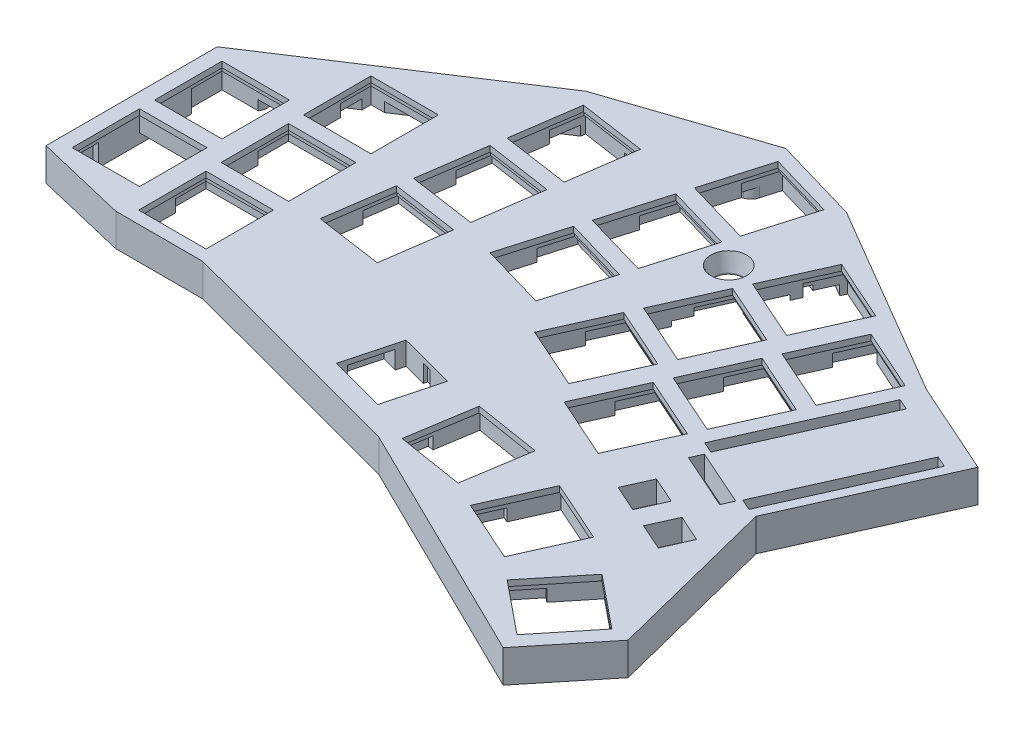
from build123d import *

# Parameters (mm, degrees)
LAYOUT_BASED_ON_OG_W     = 13.9
LAYOUT_BASED_ON_OG_H     = 13.9
LAYOUT_BASED_ON_OG_R     = 3
TOP_PLATE_DEPTH          = 1.2
BOSS_EXTRUDE2_START      = -5.5
LAYOUT_BASED_ON_OG_7_R   = 1
LAYOUT_BASED_ON_OG_7_W   = 13.9
LAYOUT_BASED_ON_OG_7_H   = 13.9
LAYOUT_BASED_ON_OG_7_R_2 = 3
BOSS_EXTRUDE2_DEPTH      = 5.5
SKETCH1_W                = 14.7
SKETCH1_H                = 14.7
CUT_EXTRUDE1_DEPTH       = 5.5
CUT_EXTRUDE2_DEPTH       = 5.7
SKETCH5_W                = 17
SKETCH5_H                = 7.4
CUT_EXTRUDE3_DEPTH       = 4.5
CUT_EXTRUDE4_DEPTH       = 2.2
SKETCH8_R                = 2.5
SKETCH8_R_2              = 2.25
CUT_EXTRUDE5_DEPTH       = 2
FILLET1_R                = 0.75
CUT_EXTRUDE6_DEPTH       = 1
CHAMFER1_SIZE            = 0.7
CHAMFER1_SIZE2           = 3.5


with BuildPart() as part:
    # Layout Based on OG → Top Plate (new body)
    with BuildSketch(Plane(origin=(0, 0, 0), x_dir=(1, 0, 0), z_dir=(0, 1, 0))):
        Polygon((44.932112641, 64.586160661), (-1, 34.518088786), (-1, -0.789622065), (17.882445607, -5.291259199), (35.868672805, -5.291259199), (85.361540778, -18.518913408), (135.758281381, -43.294373445), (147.28611756, -29.083818781), (138.36478836, 6.221102631), (152.486966257, 37.866376671), (133.367786474, 46.398597243), (93.420652892, 69.813076074), (75.723768858, 74.969568789), align=None)
        with Locations((9, 8.5)):
            Rectangle(LAYOUT_BASED_ON_OG_W, LAYOUT_BASED_ON_OG_H, mode=Mode.SUBTRACT)
        with Locations((27, 4.208740801)):
            Rectangle(LAYOUT_BASED_ON_OG_W, LAYOUT_BASED_ON_OG_H, mode=Mode.SUBTRACT)
        Polygon((82.42671831, -1.483486994), (79.405763835, -12.786753516), (67.812669966, -9.68833867), (70.833624441, 1.614927852), align=None, mode=Mode.SUBTRACT)
        Polygon((124.073654328, -30.793104213), (132.830543438, -19.998341913), (143.625305738, -28.755231024), (134.868416628, -39.549993323), align=None, mode=Mode.SUBTRACT)
        Polygon((106.968309305, -21.25715678), (112.632924584, -8.563767408), (125.326313955, -14.228382687), (119.661698676, -26.921772059), align=None, mode=Mode.SUBTRACT)
        Polygon((87.98288219, -16.369909233), (90.169189468, -2.642926298), (103.896172402, -4.829233576), (101.709865125, -18.55621651), align=None, mode=Mode.SUBTRACT)
        Polygon((103.849381672, 19.547250989), (116.542771044, 13.88263571), (110.878155765, 1.189246339), (98.184766393, 6.853861618), align=None, mode=Mode.SUBTRACT)
        Polygon((124.470413663, -5.2830693), (118.991252783, -2.837911626), (121.436410458, 2.641249254), (126.915571338, 0.19609158), align=None, mode=Mode.SUBTRACT)
        Polygon((133.940230051, -9.509116814), (128.461069171, -7.06395914), (130.906226845, -1.58479826), (136.385387725, -4.029955934), align=None, mode=Mode.SUBTRACT)
        Polygon((132.530478518, 4.557765216), (120.932921322, 9.73334896), (121.95173702, 12.01633266), (133.549294215, 6.840748916), align=None, mode=Mode.SUBTRACT)
        with Locations((9, 25.5)):
            Rectangle(LAYOUT_BASED_ON_OG_W, LAYOUT_BASED_ON_OG_H, mode=Mode.SUBTRACT)
        with Locations((27, 21.208740801)):
            Rectangle(LAYOUT_BASED_ON_OG_W, LAYOUT_BASED_ON_OG_H, mode=Mode.SUBTRACT)
        with Locations((27, 38.208740801)):
            Rectangle(LAYOUT_BASED_ON_OG_W, LAYOUT_BASED_ON_OG_H, mode=Mode.SUBTRACT)
        Polygon((40.2890512, 14.443567583), (42.28500861, 28.199517351), (56.040958378, 26.20355994), (54.045000968, 12.447610172), align=None, mode=Mode.SUBTRACT)
        Polygon((63.880386081, 25.872461201), (67.768842672, 39.217494185), (81.113875656, 35.329037594), (77.225419065, 21.98400461), align=None, mode=Mode.SUBTRACT)
        Polygon((42.730150191, 31.26739104), (44.726107602, 45.023340808), (58.48205737, 43.027383397), (56.486099959, 29.271433629), align=None, mode=Mode.SUBTRACT)
        Polygon((45.171249182, 48.091214497), (47.167206593, 61.847164265), (60.923156361, 59.851206854), (58.92719895, 46.095257086), align=None, mode=Mode.SUBTRACT)
        Polygon((88.345576683, 28.974928579), (101.038966054, 23.310313301), (95.374350775, 10.616923929), (82.680961404, 16.281539208), align=None, mode=Mode.SUBTRACT)
        Polygon((95.273523427, 44.499217739), (107.966912798, 38.83460246), (102.302297519, 26.141213088), (89.608908148, 31.805828367), align=None, mode=Mode.SUBTRACT)
        Polygon((110.777328416, 35.071540149), (123.470717788, 29.40692487), (117.806102509, 16.713535498), (105.112713137, 22.378150777), align=None, mode=Mode.SUBTRACT)
        Polygon((122.242660591, 13.036314755), (119.959676891, 14.055130453), (132.389228402, 41.907531592), (134.672212102, 40.888715895), align=None, mode=Mode.SUBTRACT)
        Polygon((148.826711042, 34.572058569), (136.39715953, 6.71965743), (134.11417583, 7.738473128), (146.543727342, 35.590874267), align=None, mode=Mode.SUBTRACT)
        Polygon((112.040659882, 37.902439937), (117.70527516, 50.595829308), (130.398664532, 44.93121403), (124.734049253, 32.237824658), align=None, mode=Mode.SUBTRACT)
        Polygon((72.524509006, 55.538757546), (85.86954199, 51.650300955), (81.981085399, 38.305267971), (68.636052415, 42.193724562), align=None, mode=Mode.SUBTRACT)
        with Locations((90.749335526, 48.215544602)):
            Circle(LAYOUT_BASED_ON_OG_R, mode=Mode.SUBTRACT)
        Polygon((96.536854892, 47.330117527), (102.201470171, 60.023506899), (114.894859542, 54.35889162), (109.230244263, 41.665502248), align=None, mode=Mode.SUBTRACT)
        Polygon((73.391718749, 58.514987924), (77.280175341, 71.860020908), (90.625208324, 67.971564317), (86.736751733, 54.626531333), align=None, mode=Mode.SUBTRACT)
    extrude(amount=TOP_PLATE_DEPTH)

    # Layout Based on OG<7> → Boss-Extrude2 (add)
    with BuildSketch(Plane(origin=(0, 0, 0), x_dir=(1, 0, 0), z_dir=(0, 1, 0)).offset(BOSS_EXTRUDE2_START)):
        Polygon((44.932112641, 64.586160661), (-1, 34.518088786), (-1, -0.789622065), (17.882445607, -5.291259199), (35.868672805, -5.291259199), (85.361540778, -18.518913408), (135.758281381, -43.294373445), (147.28611756, -29.083818781), (138.36478836, 6.221102631), (152.486966257, 37.866376671), (133.367786474, 46.398597243), (93.420652892, 69.813076074), (75.723768858, 74.969568789), align=None)
        with Locations((17.05, -2.008725367)):
            Circle(LAYOUT_BASED_ON_OG_7_R, mode=Mode.SUBTRACT)
        with Locations((9, 8.5)):
            Rectangle(LAYOUT_BASED_ON_OG_7_W, LAYOUT_BASED_ON_OG_7_H, mode=Mode.SUBTRACT)
        with Locations((27, 4.208740801)):
            Rectangle(LAYOUT_BASED_ON_OG_7_W, LAYOUT_BASED_ON_OG_7_H, mode=Mode.SUBTRACT)
        Polygon((82.42671831, -1.483486994), (79.405763835, -12.786753516), (67.812669966, -9.68833867), (70.833624441, 1.614927852), align=None, mode=Mode.SUBTRACT)
        with Locations((98.514300948, -21.642001273)):
            Circle(LAYOUT_BASED_ON_OG_7_R, mode=Mode.SUBTRACT)
        Polygon((124.073654328, -30.793104213), (132.830543438, -19.998341913), (143.625305738, -28.755231024), (134.868416628, -39.549993323), align=None, mode=Mode.SUBTRACT)
        Polygon((106.968309305, -21.25715678), (112.632924584, -8.563767408), (125.326313955, -14.228382687), (119.661698676, -26.921772059), align=None, mode=Mode.SUBTRACT)
        with Locations((143.005602273, -24.389532807)):
            Circle(LAYOUT_BASED_ON_OG_7_R, mode=Mode.SUBTRACT)
        Polygon((87.98288219, -16.369909233), (90.169189468, -2.642926298), (103.896172402, -4.829233576), (101.709865125, -18.55621651), align=None, mode=Mode.SUBTRACT)
        Polygon((103.849381672, 19.547250989), (116.542771044, 13.88263571), (110.878155765, 1.189246339), (98.184766393, 6.853861618), align=None, mode=Mode.SUBTRACT)
        Polygon((124.470413663, -5.2830693), (118.991252783, -2.837911626), (121.436410458, 2.641249254), (126.915571338, 0.19609158), align=None, mode=Mode.SUBTRACT)
        Polygon((133.940230051, -9.509116814), (128.461069171, -7.06395914), (130.906226845, -1.58479826), (136.385387725, -4.029955934), align=None, mode=Mode.SUBTRACT)
        Polygon((132.530478518, 4.557765216), (120.932921322, 9.73334896), (121.95173702, 12.01633266), (133.549294215, 6.840748916), align=None, mode=Mode.SUBTRACT)
        with Locations((9, 25.5)):
            Rectangle(LAYOUT_BASED_ON_OG_7_W, LAYOUT_BASED_ON_OG_7_H, mode=Mode.SUBTRACT)
        with Locations((27, 21.208740801)):
            Rectangle(LAYOUT_BASED_ON_OG_7_W, LAYOUT_BASED_ON_OG_7_H, mode=Mode.SUBTRACT)
        with Locations((5.901015243, 35.45)):
            Circle(LAYOUT_BASED_ON_OG_7_R, mode=Mode.SUBTRACT)
        with Locations((27, 38.208740801)):
            Rectangle(LAYOUT_BASED_ON_OG_7_W, LAYOUT_BASED_ON_OG_7_H, mode=Mode.SUBTRACT)
        Polygon((40.2890512, 14.443567583), (42.28500861, 28.199517351), (56.040958378, 26.20355994), (54.045000968, 12.447610172), align=None, mode=Mode.SUBTRACT)
        Polygon((63.880386081, 25.872461201), (67.768842672, 39.217494185), (81.113875656, 35.329037594), (77.225419065, 21.98400461), align=None, mode=Mode.SUBTRACT)
        Polygon((42.730150191, 31.26739104), (44.726107602, 45.023340808), (58.48205737, 43.027383397), (56.486099959, 29.271433629), align=None, mode=Mode.SUBTRACT)
        Polygon((45.171249182, 48.091214497), (47.167206593, 61.847164265), (60.923156361, 59.851206854), (58.92719895, 46.095257086), align=None, mode=Mode.SUBTRACT)
        with Locations((72.753454085, 70.801954714)):
            Circle(LAYOUT_BASED_ON_OG_7_R, mode=Mode.SUBTRACT)
        Polygon((88.345576683, 28.974928579), (101.038966054, 23.310313301), (95.374350775, 10.616923929), (82.680961404, 16.281539208), align=None, mode=Mode.SUBTRACT)
        Polygon((95.273523427, 44.499217739), (107.966912798, 38.83460246), (102.302297519, 26.141213088), (89.608908148, 31.805828367), align=None, mode=Mode.SUBTRACT)
        Polygon((110.777328416, 35.071540149), (123.470717788, 29.40692487), (117.806102509, 16.713535498), (105.112713137, 22.378150777), align=None, mode=Mode.SUBTRACT)
        Polygon((122.242660591, 13.036314755), (119.959676891, 14.055130453), (132.389228402, 41.907531592), (134.672212102, 40.888715895), align=None, mode=Mode.SUBTRACT)
        Polygon((148.826711042, 34.572058569), (136.39715953, 6.71965743), (134.11417583, 7.738473128), (146.543727342, 35.590874267), align=None, mode=Mode.SUBTRACT)
        Polygon((112.040659882, 37.902439937), (117.70527516, 50.595829308), (130.398664532, 44.93121403), (124.734049253, 32.237824658), align=None, mode=Mode.SUBTRACT)
        with Locations((145.3286298, 37.775717045)):
            Circle(LAYOUT_BASED_ON_OG_7_R, mode=Mode.SUBTRACT)
        Polygon((72.524509006, 55.538757546), (85.86954199, 51.650300955), (81.981085399, 38.305267971), (68.636052415, 42.193724562), align=None, mode=Mode.SUBTRACT)
        with Locations((90.749335526, 48.215544602)):
            Circle(LAYOUT_BASED_ON_OG_7_R_2, mode=Mode.SUBTRACT)
        Polygon((96.536854892, 47.330117527), (102.201470171, 60.023506899), (114.894859542, 54.35889162), (109.230244263, 41.665502248), align=None, mode=Mode.SUBTRACT)
        Polygon((73.391718749, 58.514987924), (77.280175341, 71.860020908), (90.625208324, 67.971564317), (86.736751733, 54.626531333), align=None, mode=Mode.SUBTRACT)
    extrude(amount=BOSS_EXTRUDE2_DEPTH)

    # Sketch1 → Cut-Extrude1 (cut)
    with BuildSketch(Plane.XZ):
        Polygon((124.936316134, -31.709536754), (130.926952436, -45.13348091), (117.50300828, -51.124117212), (111.512371978, -37.700173056), align=None)
        Polygon((118.00836939, -16.185247595), (123.999005692, -29.60919175), (110.575061536, -35.599828052), (104.584425234, -22.175883897), align=None)
        Polygon((111.080422646, -0.660958435), (117.071058948, -14.084902591), (103.647114792, -20.075538893), (97.65647849, -6.651594737), align=None)
        Polygon((95.576617656, -10.088636025), (101.567253958, -23.512580181), (88.143309802, -29.503216483), (82.1526735, -16.079272327), align=None)
        Polygon((102.5045644, -25.612925185), (108.495200702, -39.036869341), (95.071256546, -45.027505643), (89.080620244, -31.603561487), align=None)
        Polygon((109.432511144, -41.137214344), (115.423147446, -54.5611585), (101.99920329, -60.551794802), (96.008566988, -47.127850647), align=None)
        Polygon((119.863965557, 27.450059962), (125.854601859, 14.026115807), (112.430657703, 8.035479505), (106.440021401, 21.45942366), align=None)
        Polygon((144.187943189, 28.696587191), (134.927060461, 40.112630774), (123.511016877, 30.851748046), (132.771899605, 19.435704463), align=None)
        Polygon((104.354108811, 4.497127801), (102.041970899, 19.014152919), (87.524945781, 16.702015007), (89.837083693, 2.184989889), align=None)
        Polygon((86.365469748, -51.92243265), (82.253217094, -37.809340214), (68.140124658, -41.921592868), (72.252377311, -56.034685304), align=None)
        Polygon((91.121136082, -68.243696011), (87.008883428, -54.130603575), (72.895790992, -58.242856229), (77.008043646, -72.355948665), align=None)
        Polygon((61.376448654, -60.189623901), (59.265615997, -45.641964794), (44.71795689, -47.752797451), (46.828789547, -62.300456558), align=None)
        with Locations((27, -38.208740801)):
            Rectangle(SKETCH1_W, SKETCH1_H)
        Polygon((81.609803413, -35.601169288), (77.497550759, -21.488076852), (63.384458323, -25.600329506), (67.496710977, -39.713421942), align=None)
        Polygon((58.935349662, -43.365800443), (56.824517005, -28.818141336), (42.276857898, -30.928973994), (44.387690555, -45.476633101), align=None)
        Polygon((56.494250671, -26.541976986), (54.383418014, -11.994317879), (39.835758907, -14.105150536), (41.946591564, -28.652809644), align=None)
        with Locations((27, -21.208740801)):
            Rectangle(SKETCH1_W, SKETCH1_H)
        with Locations((27, -4.208740801)):
            Rectangle(SKETCH1_W, SKETCH1_H)
        with Locations((9, -8.5)):
            Rectangle(SKETCH1_W, SKETCH1_H)
        with Locations((9, -25.5)):
            Rectangle(SKETCH1_W, SKETCH1_H)
    extrude(amount=CUT_EXTRUDE1_DEPTH, mode=Mode.SUBTRACT)

    # Sketch4 → Cut-Extrude2 (cut)
    with BuildSketch(Plane.XZ.offset(5.5)):
        Polygon((75.052980345, 9.708478692), (74.381657128, 12.220315697), (72.449474817, 11.703913223), (73.120798034, 9.192076218), align=None)
        Polygon((83.02323238, 11.838638899), (75.052980345, 9.708478692), (77.118590243, 1.979749446), (85.088842277, 4.109909653), align=None)
        Polygon((77.789913459, -0.532087558), (77.118590243, 1.979749446), (75.186407931, 1.463346972), (75.857731148, -1.048490033), align=None)
        Polygon((75.186407931, 1.463346972), (73.120798034, 9.192076218), (65.150545999, 7.061916011), (67.216155897, -0.666813235), align=None)
    extrude(amount=-CUT_EXTRUDE2_DEPTH, mode=Mode.SUBTRACT)

    # Sketch5 → Cut-Extrude3 (cut)
    with BuildSketch(Plane.XZ.offset(5.5)):
        Polygon((90.476814804, -61.9215247), (92.546928385, -69.026074634), (76.225665023, -73.781740968), (74.155551443, -66.677191034), align=None)
        Polygon((80.965482135, -29.278997977), (83.035595716, -36.383547911), (66.714332355, -41.139214245), (64.644218774, -34.034664311), align=None)
        Polygon((85.72114847, -45.600261338), (87.79126205, -52.704811272), (71.469998689, -57.460477607), (69.399885108, -50.355927673), align=None)
        Polygon((113.926280704, -48.385044029), (116.941975169, -55.142675781), (101.417686009, -62.070622525), (98.401991544, -55.312990773), align=None)
        Polygon((106.99833396, -32.86075487), (110.014028425, -39.618386622), (94.489739265, -46.546333366), (91.4740448, -39.788701614), align=None)
        Polygon((100.070387216, -17.33646571), (103.086081681, -24.094097462), (87.561792521, -31.022044206), (84.546098056, -24.264412454), align=None)
        Polygon((115.574192206, -7.90878812), (118.589886671, -14.666419872), (103.065597511, -21.594366616), (100.049903046, -14.836734864), align=None)
        Polygon((122.50213895, -23.433077279), (125.517833415, -30.190709031), (109.993544255, -37.118655775), (106.97784979, -30.361024024), align=None)
        Polygon((129.430085694, -38.957366439), (132.445780159, -45.714998191), (116.921490999, -52.642944935), (113.905796534, -45.885313183), align=None)
        Polygon((61.617067964, -53.839261521), (62.679663996, -61.162572909), (45.855840539, -63.6036719), (44.793244507, -56.280360513), align=None)
        Polygon((59.175968973, -37.015438064), (60.238565005, -44.338749451), (43.414741547, -46.779848443), (42.352145516, -39.456537055), align=None)
        Polygon((56.734869982, -20.191614607), (57.797466013, -27.514925994), (40.973642556, -29.956024986), (39.911046525, -22.632713598), align=None)
        with Locations((27, -43.008740801)):
            Rectangle(SKETCH5_W, SKETCH5_H)
        with Locations((27, -26.008740801)):
            Rectangle(SKETCH5_W, SKETCH5_H)
        with Locations((9, -30.3)):
            Rectangle(SKETCH5_W, SKETCH5_H)
        with Locations((9, -3.7)):
            Rectangle(SKETCH5_W, SKETCH5_H)
        with Locations((27, -9.008740801)):
            Rectangle(SKETCH5_W, SKETCH5_H)
        Polygon((120.445482838, 28.968887685), (123.461177303, 22.211255933), (107.936888143, 15.283309189), (104.921193678, 22.040940941), align=None)
        Polygon((102.996775, 20.330720095), (104.160708371, 13.0228299), (87.372311976, 10.348928913), (86.208378605, 17.656819108), align=None)
        Polygon((135.09566148, 41.730213445), (139.757602445, 35.983361573), (126.555375172, 25.273497193), (121.893434207, 31.020349065), align=None)
    extrude(amount=-CUT_EXTRUDE3_DEPTH, mode=Mode.SUBTRACT)

    # Sketch6 → Cut-Extrude4 (cut)
    with BuildSketch(Plane.XZ.offset(5.5)):
        Polygon((137.298581205, 4.437482213), (129.993033365, 1.177271981), (127.547875691, 6.656432861), (134.853423531, 9.916643093), align=None)
        Polygon((125.383607143, 5.690595579), (127.828764818, 0.211434699), (120.523216978, -3.048775533), (118.078059304, 2.430385347), align=None)
    extrude(amount=-CUT_EXTRUDE4_DEPTH, mode=Mode.SUBTRACT)

    # Sketch8 → Cut-Extrude5 (cut)
    with BuildSketch(Plane.XZ.offset(5.5)):
        with BuildLine():
            Line((139.204412223, 23.173053982), (142.654833761, 18.919662182))
            Line((142.654833761, 18.919662182), (136.255917661, -6.403159671))
            Line((136.255917661, -6.403159671), (148.826711042, -34.572058569))
            Line((148.826711042, -34.572058569), (146.543727342, -35.590874267))
            ThreePointArc((146.543727342, -35.590874267), (144.309814103, -35.492733345), (142.890953422, -37.220979383))
            Line((142.890953422, -37.220979383), (131.019438182, -42.518821011))
            Line((131.019438182, -42.518821011), (116.921490999, -52.642944935))
            Line((116.921490999, -52.642944935), (116.434522933, -54.005566109))
            Line((116.434522933, -54.005566109), (100.910233773, -60.933512853))
            Line((100.910233773, -60.933512853), (91.752890515, -66.300967302))
            Line((91.752890515, -66.300967302), (75.431627153, -71.056633637))
            Line((75.431627153, -71.056633637), (75.153639873, -70.102592018))
            ThreePointArc((75.153639873, -70.102592018), (74.557701937, -69.071437541), (73.552294547, -68.433019528))
            Line((73.552294547, -68.433019528), (55.20726644, -62.246801008))
            Line((55.20726644, -62.246801008), (45.727060034, -62.716128839))
            Line((45.727060034, -62.716128839), (21.274106965, -46.708740801))
            Line((21.274106965, -46.708740801), (18.5, -44.892755365))
            Line((18.5, -44.892755365), (7.270371182, -37.541617631))
            ThreePointArc((7.270371182, -37.541617631), (8.357801287, -35.91281998), (7.937556428, -34))
            Line((7.937556428, -34), (1.65, -34))
            Line((1.65, -34), (1.65, -32.85))
            Line((1.65, -32.85), (1.65, -0.634659927))
            Line((1.65, -0.634659927), (19.65, -0.634659927))
            Line((19.65, -0.634659927), (34.35, 3.141259199))
            Line((34.35, 3.141259199), (35.570084054, 3.141259199))
            Line((35.570084054, 3.141259199), (86.358362209, 16.715129715))
            Line((86.358362209, 16.715129715), (100.310206629, 19.902828255))
            ThreePointArc((100.310206629, 19.902828255), (101.01123396, 21.76579762), (100.129367893, 23.55028814))
            Line((100.129367893, 23.55028814), (131.997484899, 39.216921535))
            Line((131.997484899, 39.216921535), (138.479921397, 24.066145827))
            Line((138.479921397, 24.066145827), (139.204412223, 23.173053982))
        make_face()
        with Locations((136.661892762, -29.397342614)):
            Circle(SKETCH8_R, mode=Mode.SUBTRACT)
        with Locations((131.696592578, -18.270993254)):
            Circle(SKETCH8_R, mode=Mode.SUBTRACT)
        with Locations((109.591444293, 3.388071472)):
            Circle(SKETCH8_R_2, mode=Mode.SUBTRACT)
        with BuildLine():
            Line((130.503779674, 9.848098828), (124.686737206, 7.25215643))
            ThreePointArc((124.686737206, 7.25215643), (122.045297688, 8.263490832), (123.05663209, 10.90493035))
            Line((123.05663209, 10.90493035), (128.873674557, 13.500872748))
            ThreePointArc((128.873674557, 13.500872748), (131.515114075, 12.489538346), (130.503779674, 9.848098828))
        make_face(mode=Mode.SUBTRACT)
        with BuildLine():
            Line((86.814692561, -7.850021098), (63.028921107, -14.20709784))
            ThreePointArc((63.028921107, -14.20709784), (59.968190125, -12.437373044), (61.737914921, -9.376642062))
            Line((61.737914921, -9.376642062), (85.523686375, -3.01956532))
            ThreePointArc((85.523686375, -3.01956532), (88.584417357, -4.789290116), (86.814692561, -7.850021098))
        make_face(mode=Mode.SUBTRACT)
        with BuildLine():
            Line((64.970718214, -56.485039592), (62.537305637, -45.272693234))
            ThreePointArc((62.537305637, -45.272693234), (63.685041764, -43.488680403), (65.469054595, -44.63641653))
            Line((65.469054595, -44.63641653), (67.902467172, -55.848762888))
            ThreePointArc((67.902467172, -55.848762888), (66.754731045, -57.632775719), (64.970718214, -56.485039592))
        make_face(mode=Mode.SUBTRACT)
        with BuildLine():
            Line((38.423692073, -53.453161546), (37.944396883, -46.816793128))
            ThreePointArc((37.944396883, -46.816793128), (39.332447725, -45.212637631), (40.936603222, -46.600688473))
            Line((40.936603222, -46.600688473), (41.415898413, -53.237056891))
            ThreePointArc((41.415898413, -53.237056891), (40.027847571, -54.841212388), (38.423692073, -53.453161546))
        make_face(mode=Mode.SUBTRACT)
        with BuildLine():
            Line((58.13403364, -1.541487636), (45.001022976, -5.051466566))
            ThreePointArc((45.001022976, -5.051466566), (41.940291994, -3.28174177), (43.71001679, -0.221010787))
            Line((43.71001679, -0.221010787), (56.843027454, 3.288968143))
            ThreePointArc((56.843027454, 3.288968143), (59.903758436, 1.519243347), (58.13403364, -1.541487636))
        make_face(mode=Mode.SUBTRACT)
    extrude(amount=-CUT_EXTRUDE5_DEPTH, mode=Mode.SUBTRACT)

    # Fillet1
    fillet1_edges = [part.edges().sort_by_distance(p)[0] for p in [
        (41.940291994, -3.5, -3.28174177),
        (51.567528308, -3.5, -3.296477101),
        (50.276522122, -3.5, 1.533978678),
        (59.903758436, -3.5, 1.519243347),
        (38.184044478, -3.5, -50.134977337),
        (40.027847571, -3.5, -54.841212388),
        (41.176250818, -3.5, -49.918872682),
        (39.332447725, -3.5, -45.212637631),
        (63.685041764, -3.5, -43.488680403),
        (66.685760884, -3.5, -50.242589709),
        (63.754011925, -3.5, -50.878866413),
        (66.754731045, -3.5, -57.632775719),
        (74.921806834, -3.5, -11.028559469),
        (88.584417357, -3.5, -4.789290116),
        (59.968190125, -3.5, -12.437373044),
        (73.630800648, -3.5, -6.198103691),
        (127.59525844, -3.5, 8.550127629),
        (131.515114075, -3.5, 12.489538346),
        (125.965153324, -3.5, 12.202901549),
        (122.045297688, -3.5, 8.263490832),
        (107.341444293, -3.5, 3.388071472),
        (134.161892762, -3.5, -29.397342614),
        (129.196592578, -3.5, -18.270993254),
    ]]
    fillet(fillet1_edges, radius=FILLET1_R)

    # Sketch9 → Cut-Extrude6 (cut)
    with BuildSketch(Plane.XZ.offset(3.5)):
        Polygon((92.272615366, -35.673430804), (81.476293661, -39.634420283), (89.226055687, -60.757658401), (100.022377391, -56.796668921), align=None)
    extrude(amount=-CUT_EXTRUDE6_DEPTH, mode=Mode.SUBTRACT)

    # Chamfer1
    chamfer1_edges = [part.edges().sort_by_distance(p)[0] for p in [
        (87.749335526, 1.2, -48.215544602),
    ]]
    chamfer1_side = [part.faces().sort_by_distance(p)[0] for p in [
        (81.179535673, 1.2, -18.788906196),
    ]]
    chamfer(chamfer1_edges, length=CHAMFER1_SIZE, length2=CHAMFER1_SIZE2, reference=chamfer1_side[0])


solid = part.part
